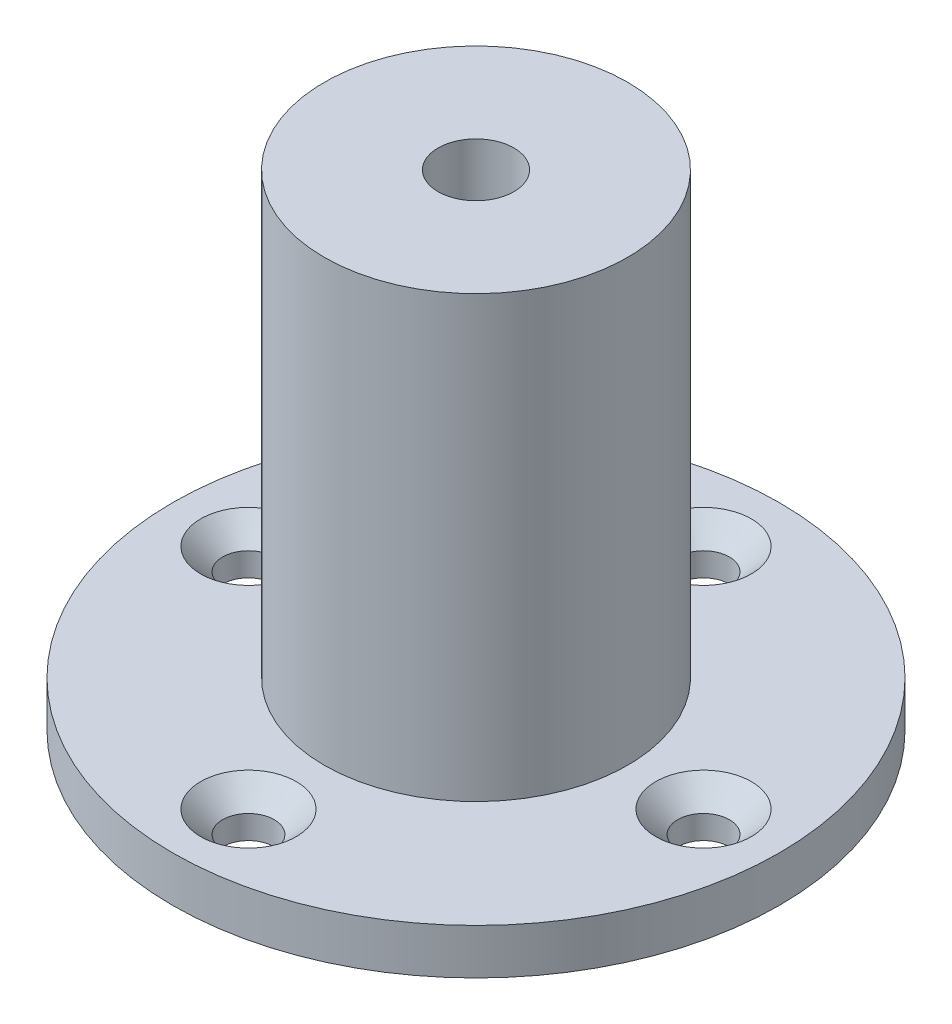
from build123d import *

# Parameters (mm, degrees)
SKETCH1_R             = 10
BOSS_EXTRUDE1_DEPTH   = 32
SKETCH2_R             = 20
BOSS_EXTRUDE2_DEPTH   = 3
CIRPATTERN1_COUNT     = 4
M6_TAPPED_HOLE1_D     = 5
M6_TAPPED_HOLE1_DEPTH = 17
M6_TAPPED_HOLE1_TIP   = 1.502151548


with BuildPart() as part:
    # Sketch1 → Boss-Extrude1 (new body)
    with BuildSketch(Plane(origin=(0, 0, 0), x_dir=(1, 0, 0), z_dir=(0, 1, 0))):
        Circle(SKETCH1_R)
    extrude(amount=BOSS_EXTRUDE1_DEPTH)

    # Sketch2 → Boss-Extrude2 (add)
    with BuildSketch(Plane.XZ):
        Circle(SKETCH2_R)
    extrude(amount=-BOSS_EXTRUDE2_DEPTH)

    # Sketch3 → CSK for M3 Countersunk Flat Head Screw1 (revolve, cut)
    with BuildSketch(Plane(origin=(0, 3, -15), x_dir=(0, 0, 1), z_dir=(1, 0, 0))):
        Polygon((0, 0), (0, 3), (1.7, 3), (1.7, 1.45), (3.15, 0), align=None)
    csk_for_m3_countersunk_flat_head_screw1 = revolve(axis=Axis((0, 9.35, -15), (0, -1, 0)), mode=Mode.SUBTRACT)

    # CirPattern1: CSK for M3 Countersunk Flat Head Screw1 ×4 about axis
    cirpattern1_axis = Axis((0, 3, 0), (0, -1, 0))
    for i in range(1, CIRPATTERN1_COUNT):
        add(csk_for_m3_countersunk_flat_head_screw1.rotate(cirpattern1_axis, i * 360 / CIRPATTERN1_COUNT), mode=Mode.SUBTRACT)

    # M6 Tapped Hole1
    with Locations(Plane(origin=(0, 32, 0), x_dir=(1, 0, 0), z_dir=(0, 1, 0))):
        with Locations((0, 0)):
            Hole(M6_TAPPED_HOLE1_D / 2, depth=M6_TAPPED_HOLE1_DEPTH)
            with Locations((0, 0, -(M6_TAPPED_HOLE1_DEPTH + M6_TAPPED_HOLE1_TIP / 2))):  # 118° drill point
                Cone(0, M6_TAPPED_HOLE1_D / 2, M6_TAPPED_HOLE1_TIP, mode=Mode.SUBTRACT)


solid = part.part
